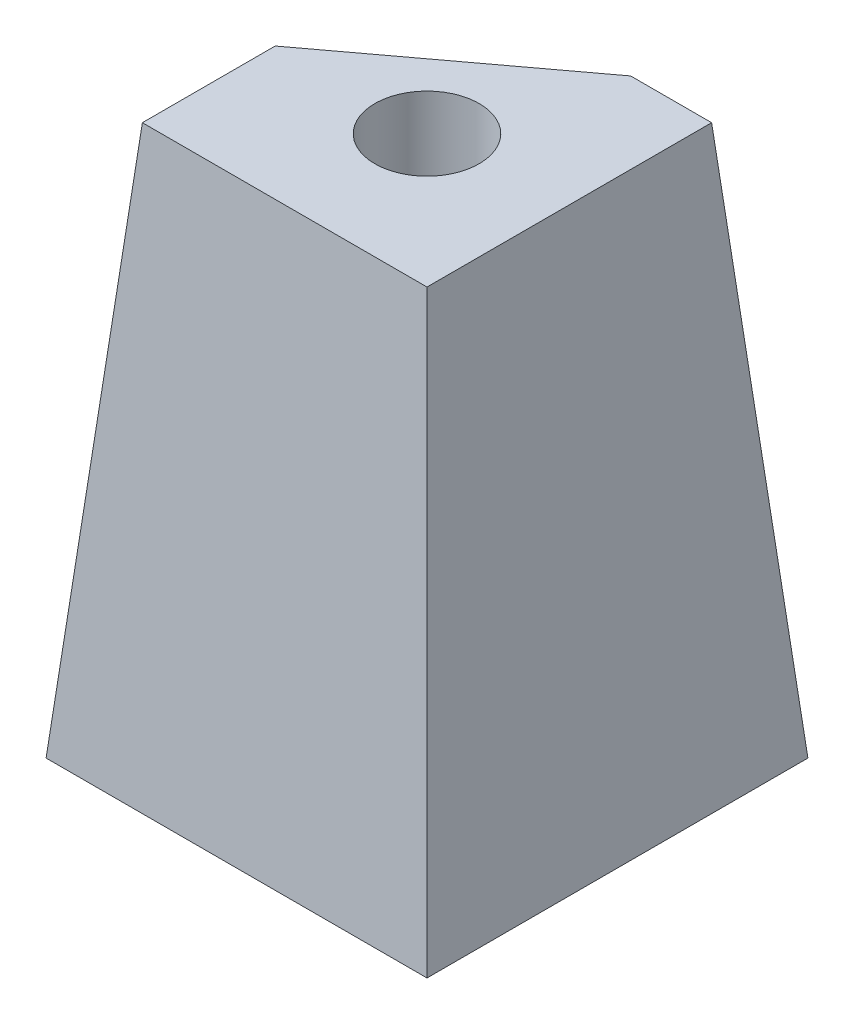
from build123d import *

# Parameters (mm, degrees)
BOSS_EXTRUDE1_DEPTH = 29
SKETCH2_R           = 1.5
SKETCH2_R_2         = 2
CUT_EXTRUDE1_DEPTH  = 10
SKETCH3_R           = 2.75
CUT_EXTRUDE2_DEPTH  = 6
DRAFT1_ANGLE        = 5


with BuildPart() as part:
    # Sketch1 → Boss-Extrude1 (new body)
    with BuildSketch(Plane(origin=(0, 0, 0), x_dir=(1, 0, 0), z_dir=(0, 1, 0))):
        Polygon((-4.579646018, -0.201327434), (6.153177369, 7.798672566), (10.420353982, 7.798672566), (10.420353982, -7.201327434), (-4.579646018, -7.201327434), align=None)
    extrude(amount=BOSS_EXTRUDE1_DEPTH)

    # Sketch2 → Cut-Extrude1 (cut)
    with BuildSketch(Plane.XZ):
        with Locations((-0.579646018, 2.201327434)):
            Circle(SKETCH2_R)
        with Locations((7.420353982, 2.201327434)):
            Circle(SKETCH2_R_2)
    extrude(amount=-CUT_EXTRUDE1_DEPTH, mode=Mode.SUBTRACT)

    # Sketch3 → Cut-Extrude2 (cut)
    with BuildSketch(Plane(origin=(0, 29, 0), x_dir=(1, 0, 0), z_dir=(0, 1, 0))):
        with Locations((3.420353982, -0.201327434)):
            Circle(SKETCH3_R)
    extrude(amount=-CUT_EXTRUDE2_DEPTH, mode=Mode.SUBTRACT)

    # Draft1
    draft1_faces = [part.faces().sort_by_distance(p)[0] for p in [
        (8.286765676, 14.5, -7.798672566),
        (10.420353982, 14.5, -0.298672566),
        (2.920353982, 14.5, 7.201327434),
        (-4.579646018, 14.5, 3.701327434),
        (0.786765676, 14.5, -3.798672566),
    ]]
    draft(draft1_faces, Plane.ZX.offset(29), DRAFT1_ANGLE)


solid = part.part
